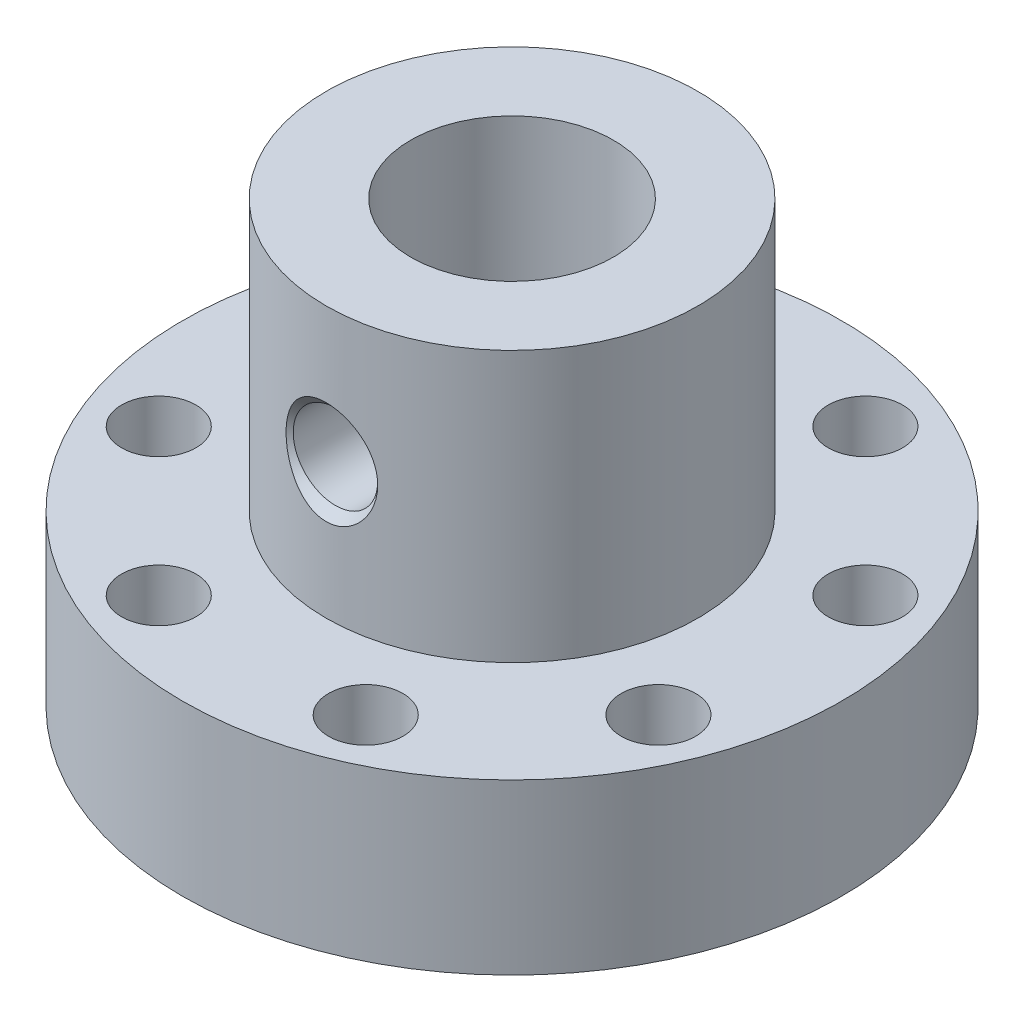
from build123d import *

# Parameters (mm, degrees)
SKETCH2_R           = 9.75
SKETCH2_R_2         = 4
BOSS_EXTRUDE1_DEPTH = 3
SKETCH3_R           = 5.5
SKETCH3_R_2         = 3
BOSS_EXTRUDE2_DEPTH = 10
SKETCH16_R          = 9.75
SKETCH16_R_2        = 5.5
BOSS_EXTRUDE3_DEPTH = 2
SKETCH5_R           = 1.1
CUT_EXTRUDE1_DEPTH  = 16.941298617


# Read off the part's stored shape, not the designer's step: M3x0.5 Tapped Hole1
with BuildPart() as part:
    # Sketch2 → Boss-Extrude1 (new body)
    with BuildSketch(Plane(origin=(0, 0, 0), x_dir=(1, 0, 0), z_dir=(0, 1, 0))):
        with Locations(Location((0, 0, 0), (0, 0, 270))):
            Circle(SKETCH2_R)
        with Locations(Location((0, 0, 0), (0, 0, 270))):
            Circle(SKETCH2_R_2, mode=Mode.SUBTRACT)
    extrude(amount=BOSS_EXTRUDE1_DEPTH)

    # Sketch3 → Boss-Extrude2 (add)
    with BuildSketch(Plane(origin=(0, 3, 0), x_dir=(1, 0, 0), z_dir=(0, 1, 0))):
        with Locations(Location((0, 0, 0), (0, 0, 270))):
            Circle(SKETCH3_R)
        with Locations(Location((0, 0, 0), (0, 0, 270))):
            Circle(SKETCH3_R_2, mode=Mode.SUBTRACT)
    extrude(amount=BOSS_EXTRUDE2_DEPTH)

    # Sketch16 → Boss-Extrude3 (add)
    with BuildSketch(Plane(origin=(0, 3, 0), x_dir=(1, 0, 0), z_dir=(0, 1, 0))):
        with Locations(Location((0, 0, 0), (0, 0, 270))):
            Circle(SKETCH16_R)
        with Locations(Location((0, 0, 0), (0, 0, 270))):
            Circle(SKETCH16_R_2, mode=Mode.SUBTRACT)
    extrude(amount=BOSS_EXTRUDE3_DEPTH)

    # M3x0.5 Tapped Hole1 outline → M3x0.5 Tapped Hole1 (revolve, cut)
    with BuildSketch(Plane.XZ.offset(-9)):
        Polygon((1.525000456, 5.500000456), (0, 5.500000456), (0, 2.727054604), (1.25, 2.727054604), (1.25, 5.225), align=None)
    revolve(axis=Axis((0, 9, 0), (0, 0, 1)), mode=Mode.SUBTRACT)

    # Sketch5 → Cut-Extrude1 (cut, through all)
    with BuildSketch(Plane(origin=(0, 5, 0), x_dir=(1, 0, 0), z_dir=(0, 1, 0))):
        with Locations(Location((3.061467459, 7.39103626, 0), (0, 0, 270))):
            Circle(SKETCH5_R)
        with Locations(Location((7.39103626, 3.061467459, 0), (0, 0, 270))):
            Circle(SKETCH5_R)
        with Locations(Location((7.39103626, -3.061467459, 0), (0, 0, 270))):
            Circle(SKETCH5_R)
        with Locations(Location((3.061467459, -7.39103626, 0), (0, 0, 270))):
            Circle(SKETCH5_R)
        with Locations(Location((-3.061467459, -7.39103626, 0), (0, 0, 270))):
            Circle(SKETCH5_R)
        with Locations(Location((-7.39103626, -3.061467459, 0), (0, 0, 270))):
            Circle(SKETCH5_R)
        with Locations(Location((-7.39103626, 3.061467459, 0), (0, 0, 270))):
            Circle(SKETCH5_R)
        with Locations(Location((-3.061467459, 7.39103626, 0), (0, 0, 270))):
            Circle(SKETCH5_R)
    extrude(amount=-CUT_EXTRUDE1_DEPTH, mode=Mode.SUBTRACT)


solid = part.part
